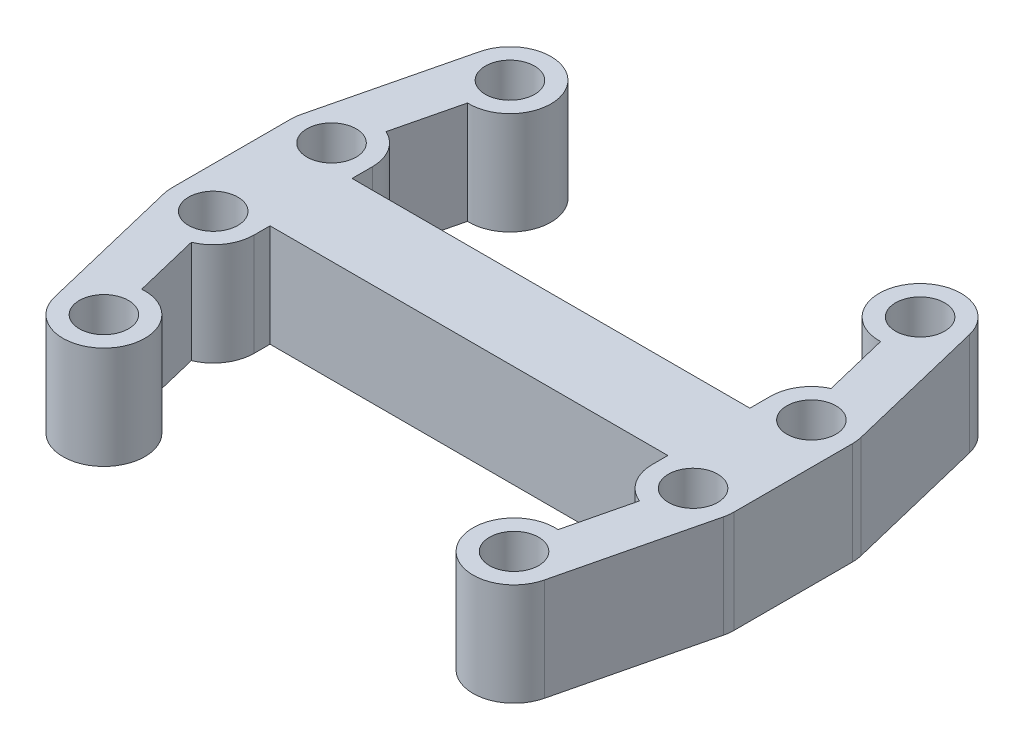
from build123d import *

# Parameters (mm, degrees)
SKETCH2_R           = 1.905
BOSS_EXTRUDE1_DEPTH = 7.9375


with BuildPart() as part:
    # Sketch2 → Boss-Extrude1 (new body)
    with BuildSketch(Plane(origin=(0, 0, 0), x_dir=(1, 0, 0), z_dir=(0, 1, 0))):
        with BuildLine():
            Line((-17.222533644, 7.635623624), (-15.992089152, 12.702159769))
            ThreePointArc((-15.992089152, 12.702159769), (-13.343274843, 17.790983489), (-18.96031801, 16.624291517))
            Line((-18.96031801, 16.624291517), (-21.65906801, 5.511791517))
            ThreePointArc((-21.65906801, 5.511791517), (-21.726249777, 5.139819704), (-21.74875, 4.7625))
            Line((-21.74875, 4.7625), (-21.74875, -4.397375))
            ThreePointArc((-21.74875, -4.397375), (-21.726434075, -4.773151689), (-21.659800003, -5.143645982))
            Line((-21.659800003, -5.143645982), (-18.961050003, -16.303770982))
            ThreePointArc((-18.961050003, -16.303770982), (-13.3068551, -17.424384241), (-16.11725409, -12.391755545))
            Line((-16.11725409, -12.391755545), (-17.34273843, -7.324017362))
            ThreePointArc((-17.34273843, -7.324017362), (-15.929030097, -6.154099689), (-15.39875, -4.397375))
            Line((-15.39875, -4.397375), (-15.39875, -3.175))
            Line((-15.39875, -3.175), (15.39875, -3.175))
            Line((15.39875, -3.175), (15.39875, -4.397375))
            ThreePointArc((15.39875, -4.397375), (15.929030097, -6.154099689), (17.34273843, -7.324017362))
            Line((17.34273843, -7.324017362), (16.11725409, -12.391755545))
            ThreePointArc((16.11725409, -12.391755545), (13.3068551, -17.424384241), (18.961050003, -16.303770982))
            Line((18.961050003, -16.303770982), (21.659800003, -5.143645982))
            ThreePointArc((21.659800003, -5.143645982), (21.726434075, -4.773151689), (21.74875, -4.397375))
            Line((21.74875, -4.397375), (21.74875, 4.7625))
            ThreePointArc((21.74875, 4.7625), (21.726249777, 5.139819704), (21.65906801, 5.511791517))
            Line((21.65906801, 5.511791517), (18.96031801, 16.624291517))
            ThreePointArc((18.96031801, 16.624291517), (13.343274843, 17.790983489), (15.992089152, 12.702159769))
            Line((15.992089152, 12.702159769), (17.222533644, 7.635623624))
            ThreePointArc((17.222533644, 7.635623624), (15.893196239, 6.464045337), (15.39875, 4.7625))
            Line((15.39875, 4.7625), (15.39875, 3.175))
            Line((15.39875, 3.175), (-15.39875, 3.175))
            Line((-15.39875, 3.175), (-15.39875, 4.7625))
            ThreePointArc((-15.39875, 4.7625), (-15.893196239, 6.464045337), (-17.222533644, 7.635623624))
        make_face()
        with Locations((-15.875, 15.875)):
            Circle(SKETCH2_R, mode=Mode.SUBTRACT)
        with Locations((-18.57375, 4.7625)):
            Circle(SKETCH2_R, mode=Mode.SUBTRACT)
        with Locations((-18.57375, -4.397375)):
            Circle(SKETCH2_R, mode=Mode.SUBTRACT)
        with Locations((-15.875, -15.5575)):
            Circle(SKETCH2_R, mode=Mode.SUBTRACT)
        with Locations((15.875, -15.5575)):
            Circle(SKETCH2_R, mode=Mode.SUBTRACT)
        with Locations((18.57375, -4.397375)):
            Circle(SKETCH2_R, mode=Mode.SUBTRACT)
        with Locations((18.57375, 4.7625)):
            Circle(SKETCH2_R, mode=Mode.SUBTRACT)
        with Locations((15.875, 15.875)):
            Circle(SKETCH2_R, mode=Mode.SUBTRACT)
    extrude(amount=BOSS_EXTRUDE1_DEPTH)


solid = part.part
